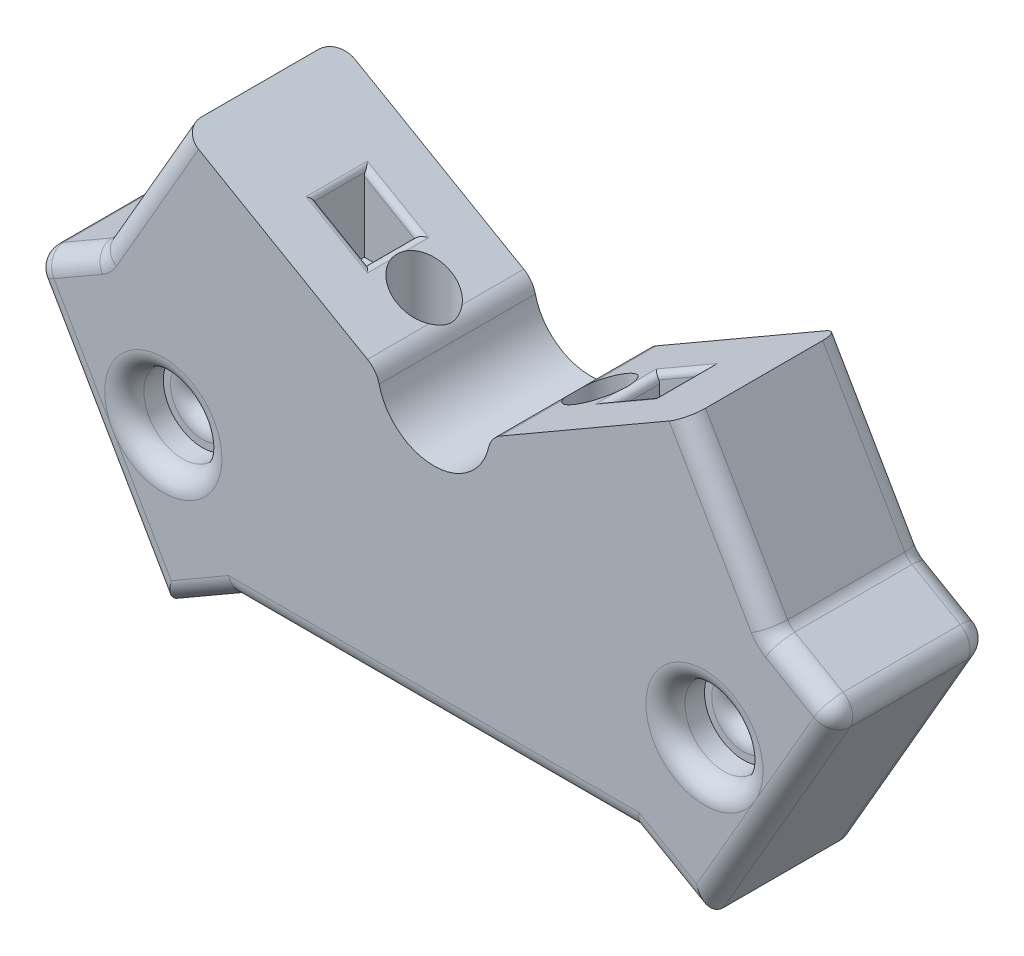
from build123d import *

# Parameters (mm, degrees)
SKETCH3_R                      = 2.286
SKETCH3_R_2                    = 0.5000000000000009
SKETCH3_R_3                    = 0.5000000000000026
SKETCH3_R_4                    = 0.5000000000000006
BOSS_EXTRUDE2_DEPTH            = 6.35
CBORE_FOR_M2_SHCS1_D           = 2.2
CBORE_FOR_M2_SHCS1_CBORE_D     = 4.4
CBORE_FOR_M2_SHCS1_CBORE_DEPTH = 2
CUT_EXTRUDE1_DEPTH             = 33.276392769419495
CUT_EXTRUDE1_DEPTH_BACK        = 7.619999999999999
SKETCH12_R                     = 1.5875000000000001
SKETCH12_R_2                   = 1.5875000000000024
SKETCH12_R_3                   = 1.5875000000000008
CUT_EXTRUDE4_DEPTH             = 1.5875
CUT_EXTRUDE5_START             = -1.5875
SKETCH13_R                     = 1.5875000000000008
SKETCH13_R_2                   = 1.5875000000000001
CUT_EXTRUDE5_DEPTH             = 1.5875
FILLET1_R                      = 0.79375
FILLET2_R                      = 0.79375
CUT_EXTRUDE6_DEPTH             = 24.578353474734403
FILLET3_R                      = 0.396875
FILLET5_R                      = 1
CUT_EXTRUDE10_DEPTH            = 5
FILLET4_R                      = 0.25


# Read off the part's stored shape, not the designer's step: Cut-Extrude9
# Some blends are built 0.0001 mm under size
with BuildPart() as part:
    # Sketch3 → Boss-Extrude2 (new body)
    with BuildSketch(Plane.XY):
        Polygon((5.55625, 12.601292700445448), (5.5562499999999995, 15.874999999999996), (-1.52e-15, 15.875), (-5.556249999999993, 15.874999999999948), (-5.556249999999972, 12.6012927004454), (-13.691164599109024, -1.488792700445434), (-16.526278285077815, -3.125646350222706), (-13.748153285077814, -7.9374999999999964), (-10.970028285077763, -12.749353649777264), (-8.134914599108987, -11.112499999999965), (8.134914599109248, -11.112499999999882), (10.970028285078037, -12.749353649777156), (13.74815328507804, -7.937499999999867), (16.52627828507799, -3.1256463502225516), (13.691164599109184, -1.4887927004453034), align=None)
        Circle(SKETCH3_R, mode=Mode.SUBTRACT)
        with Locations((-10.998522628062338, -6.350000000000054)):
            Circle(SKETCH3_R_2, mode=Mode.SUBTRACT)
        with Locations((10.99852262806243, -6.34999999999989)):
            Circle(SKETCH3_R_3, mode=Mode.SUBTRACT)
        with Locations((0, 12.7)):
            Circle(SKETCH3_R_4, mode=Mode.SUBTRACT)
    extrude(amount=BOSS_EXTRUDE2_DEPTH)

    # CBORE for M2 SHCS1 (through all)
    with Locations(Plane(origin=(2.7499307298664473, 15.875000000000007, 1.2032957578560237), x_dir=(-1, -1.25e-15, 0), z_dir=(-1.25e-15, 1, 0))):
        with Locations((6.32180573, 1.971704242), (-0.82194427, 1.971704242)):
            CounterBoreHole(CBORE_FOR_M2_SHCS1_D / 2, CBORE_FOR_M2_SHCS1_CBORE_D / 2, CBORE_FOR_M2_SHCS1_CBORE_DEPTH)

    # Sketch10 → Cut-Extrude1 (cut, two sides: drawn at the far end of the back side and taken through both)
    with BuildSketch(Plane.XZ.offset(11.112499999999923).offset(-CUT_EXTRUDE1_DEPTH_BACK)):
        Polygon((1.5718750000000006, 2.0202994616207213), (3.5718750000000257, 0.8655989232414972), (5.571875000000009, 2.020299461620783), (5.571874999999974, 4.329700538379291), (3.571874999999952, 5.484401076758515), (1.571874999999965, 4.32970053837923), align=None)
        Polygon((-5.571874999999975, 2.0202994616207475), (-3.5718749999999746, 0.8655989232414972), (-1.5718749999999753, 2.0202994616207497), (-1.5718749999999753, 4.329700538379252), (-3.571874999999975, 5.484401076758503), (-5.5718749999999755, 4.329700538379251), align=None)
    extrude(amount=CUT_EXTRUDE1_DEPTH + CUT_EXTRUDE1_DEPTH_BACK, mode=Mode.SUBTRACT)

    # Sketch12 → Cut-Extrude4 (cut)
    with BuildSketch(Plane.XY.offset(6.35)):
        with Locations((0, 12.7)):
            Circle(SKETCH12_R)
        with Locations((10.99852262806243, -6.34999999999989)):
            Circle(SKETCH12_R_2)
        with Locations((-10.998522628062338, -6.350000000000054)):
            Circle(SKETCH12_R_3)
    extrude(amount=-CUT_EXTRUDE4_DEPTH, mode=Mode.SUBTRACT)

    # Sketch13 → Cut-Extrude5 (cut)
    with BuildSketch(Plane(origin=(0, 0, 0), x_dir=(-1, 0, 0), z_dir=(0, 0, -1)).offset(CUT_EXTRUDE5_START)):
        with Locations(Location((-10.99852262806243, -6.34999999999989, 0), (0, 0, 180))):
            Circle(SKETCH13_R)
        with Locations(Location((0, 12.7, 0), (0, 0, 180))):
            Circle(SKETCH13_R_2)
        with Locations(Location((10.998522628062338, -6.350000000000054, 0), (0, 0, 180))):
            Circle(SKETCH13_R)
    extrude(amount=CUT_EXTRUDE5_DEPTH, mode=Mode.SUBTRACT)

    # Fillet1
    fillet1_edges = [part.edges().sort_by_distance(p)[0] for p in [
        (-0.5000000000000006, 12.7, 4.762499999999999),
        (-1.5875000000000001, 12.7, 6.35),
        (10.498522628062428, -6.34999999999989, 4.762499999999999),
        (9.411022628062428, -6.349999999999891, 6.35),
        (-11.49852262806234, -6.350000000000054, 4.762499999999999),
        (-12.586022628062338, -6.350000000000054, 6.35),
        (10.498522628062428, -6.34999999999989, 1.5875),
        (9.41102262806243, -6.34999999999989, 0),
        (-0.5000000000000006, 12.7, 1.5875),
        (-1.5875000000000001, 12.7, 0),
        (-11.49852262806234, -6.350000000000054, 1.5875),
        (-12.586022628062338, -6.350000000000054, 0),
    ]]
    fillet(fillet1_edges, radius=FILLET1_R)

    # Fillet2
    fillet2_edges = [part.edges().sort_by_distance(p)[0] for p in [
        (3.55e-15, 15.874999999999972, 6.35),
        (15.108721442093586, -2.3072195253339274, 0),
        (13.748153285078013, -7.9374999999998535, 0),
        (9.552471442093642, -11.93092682488852, 0),
        (1.2967e-13, -11.112499999999923, 0),
        (-9.552471442093374, -11.930926824888614, 0),
        (-13.74815328507779, -7.937499999999986, 0),
        (-5.556249999999983, 14.238146350222674, 6.35),
        (-15.108721442093419, -2.30721952533407, 0),
        (-9.623707299554498, 5.5562499999999835, 0),
        (-5.556249999999983, 14.238146350222674, 0),
        (2.66e-15, 15.874999999999972, 0),
        (5.55625, 14.238146350222722, 0),
        (9.623707299554592, 5.556250000000072, 0),
        (-9.623707299554498, 5.5562499999999835, 6.35),
        (-15.108721442093419, -2.30721952533407, 6.35),
        (13.691164599109184, -1.4887927004453034, 3.175),
        (16.52627828507799, -3.1256463502225516, 3.175),
        (-16.526278285077815, -3.125646350222706, 3.175),
        (-13.691164599109024, -1.488792700445434, 3.175),
        (-5.556249999999972, 12.6012927004454, 3.175),
        (-13.74815328507779, -7.937499999999985, 6.35),
        (-5.556249999999993, 15.874999999999948, 5.237435748189045),
        (5.5562499999999995, 15.874999999999996, 5.237435747910032),
        (5.55625, 12.601292700445448, 3.175),
        (-9.552471442093374, -11.930926824888614, 6.35),
        (1.2967e-13, -11.112499999999923, 6.35),
        (9.552471442093642, -11.93092682488852, 6.35),
        (9.623707299554592, 5.556250000000072, 6.35),
        (13.748153285078013, -7.937499999999854, 6.35),
        (15.108721442093586, -2.3072195253339274, 6.35),
        (5.5562499999999995, 15.874999999999996, 1.112564251945991),
        (5.55625, 14.238146350222722, 6.35),
        (-5.556249999999993, 15.874999999999948, 1.1125642516669791),
    ]]
    fillet(fillet2_edges, radius=FILLET2_R - 0.0001)  # a hair under: the kernel refuses the full size

    # Sketch14 → Cut-Extrude6 (cut, through all)
    with BuildSketch(Plane.XY.offset(6.35)):
        Polygon((10.14022568682441, 4.661613910205134), (10.248478862297468, 4.474113910205129), (2.2825799000254072, -0.12499999999999974), (-2.2825799000254072, -0.1250000000000003), (-10.248478862297468, 4.474113910205126), (-10.14022568682441, 4.661613910205132), (-2.2825799000254072, 0.12499999999999971), (2.2825799000254072, 0.12500000000000028), align=None)
    extrude(amount=-CUT_EXTRUDE6_DEPTH, mode=Mode.SUBTRACT)


with BuildPart() as cut_extrude6_piece_1:
    # of the separate pieces the step leaves, piece 1, a body of its own (cut_extrude6_pieces)
    add(part.part.solids().sort_by_distance((10.679532223, -11.665207588, 0))[0])

    # Fillet5
    # the kernel refuses this fillet: 1 mm, written as the material it takes off along each edge
    with BuildSketch(Plane(origin=(2.2825799000254072, -0.12499999999999974, 7.55251195702248), x_dir=(-0.14208852902464092, -0.9898539538333995, 0), z_dir=(0, 0, -1))) as fillet5_piece_1:
        with BuildLine():
            CenterArc((0.48894342934782964, -0.9961425219198927), FILLET5_R, 95.0341838179314, 46.79709768810751)
            Line((-0.29725097619730156, -0.3781632692830927), (0, 0))
            ThreePointArc((0, 0), (0.20059667614665141, -0.00881819489112478), (0.40119335229330066, -1e-17))
        make_face()
    extrude(amount=8.755023914044958, mode=Mode.SUBTRACT)
    with BuildSketch(Plane(origin=(-2.2825799000254072, -0.1250000000000003, 7.552511957022478), x_dir=(-0.866025403784439, 0.4999999999999995, 0), z_dir=(0, 0, -1))) as fillet5_piece_2:
        with BuildLine():
            CenterArc((0.4810047828089911, -1), FILLET5_R, 89.99999999999999, 46.79709768799087)
            ThreePointArc((-0.24792916801167347, -0.31541596911629843), (-0.11703176851653273, -0.16315744604572677), (0, 0))
            Line((0, 0), (0.4810047828089915, -1e-17))
        make_face()
    extrude(amount=8.755023914044957, mode=Mode.SUBTRACT)

    # Sketch18 → Cut-Extrude10 (cut)
    with BuildSketch(Plane(origin=(-7.6e-16, 4.474113910205136, 4.237e-14), x_dir=(-1, -1.7e-16, 0), z_dir=(-1.7e-16, 1, 1.238e-14))):
        Polygon((7, 4.1749999999999785), (7, 2.174999999999979), (5, 2.174999999999978), (5, 4.174999999999979), align=None)
        Polygon((-7, 4.174999999999977), (-5, 4.1749999999999785), (-5, 2.174999999999976), (-7, 2.174999999999977), align=None)
    extrude(amount=-CUT_EXTRUDE10_DEPTH, mode=Mode.SUBTRACT)

    # Fillet4
    # the kernel refuses this fillet: 0.25 mm, written as the material it takes off along each edge
    with BuildSketch(Plane(origin=(4.458734122634719, 1.1314032262216247, 2.1749999999999767), x_dir=(5.33e-15, 4.3e-15, -1), z_dir=(0.8660254037844389, 0.49999999999999956, 6.7690775915540635e-15))) as fillet4_piece_1_section:
        with BuildLine():
            CenterArc((FILLET4_R, -FILLET4_R), FILLET4_R, 89.99999999999993, 90.00000000000063)
            Line((1.95e-15, -FILLET4_R), (0, 0))
            Line((0, 0), (FILLET4_R, 0))
        make_face()
    fillet4_piece_1 = extrude(amount=3.559401076758515, mode=Mode.PRIVATE)
    fillet4_piece_1 = split(fillet4_piece_1, bisect_by=Plane(origin=(6.999999999999999, 1.1314032262216251, 2.1749999999999767), z_dir=(-1, -1.7e-16, 0)), keep=Keep.TOP, mode=Mode.PRIVATE)
    fillet4_piece_1 = split(fillet4_piece_1, bisect_by=Plane(origin=(4.999999999999999, 1.1314032262216247, 2.1749999999999767), z_dir=(1, 1.7e-16, 0)), keep=Keep.TOP, mode=Mode.PRIVATE)
    add(fillet4_piece_1, mode=Mode.SUBTRACT)
    with BuildSketch(Plane(origin=(5, 1.443903226221629, 4.174999999999984), x_dir=(-0.8660254037844387, -0.4999999999999997, 0), z_dir=(0, 0, -1))) as fillet4_piece_2:
        with BuildLine():
            CenterArc((FILLET4_R * 1.73205080757, -FILLET4_R), FILLET4_R, 90, 119.9999999999998)
            Line((FILLET4_R * 0.866025403784, -FILLET4_R * 1.5), (0, 0))
            Line((0, 0), (FILLET4_R * 1.73205080757, -1e-17))
        make_face()
    extrude(amount=2.0000000000000036, mode=Mode.SUBTRACT)
    with BuildSketch(Plane(origin=(7.541265877365268, 2.9111037646008757, 4.175000000000001), x_dir=(-3.4e-15, -4.96e-15, 1), z_dir=(-0.8660254037844389, -0.49999999999999956, -5.423003711085568e-15))) as fillet4_piece_3_section:
        with BuildLine():
            CenterArc((FILLET4_R, -FILLET4_R), FILLET4_R, 90.00000000000016, 89.99999999999913)
            Line((-2.01e-15, -FILLET4_R), (0, 0))
            Line((0, 0), (FILLET4_R, 0))
        make_face()
    fillet4_piece_3 = extrude(amount=3.559401076758489, mode=Mode.PRIVATE)
    fillet4_piece_3 = split(fillet4_piece_3, bisect_by=Plane(origin=(6.999999999999999, 2.9111037646008757, 4.175000000000001), z_dir=(-1, -1.7e-16, 0)), keep=Keep.TOP, mode=Mode.PRIVATE)
    fillet4_piece_3 = split(fillet4_piece_3, bisect_by=Plane(origin=(4.999999999999999, 2.9111037646008753, 4.175000000000001), z_dir=(1, 1.7e-16, 0)), keep=Keep.TOP, mode=Mode.PRIVATE)
    add(fillet4_piece_3, mode=Mode.SUBTRACT)
    with BuildSketch(Plane(origin=(7, 2.5986037646008793, 2.1749999999999963), x_dir=(0.8660254037844398, 0.499999999999998, 0), z_dir=(0, 0, 1))) as fillet4_piece_4:
        with BuildLine():
            CenterArc((FILLET4_R * 0.57735026919, -FILLET4_R), FILLET4_R, 90.00000000000011, 59.999999999999915)
            Line((-FILLET4_R * 0.288675134595, -FILLET4_R * 0.5), (0, 0))
            Line((0, 0), (FILLET4_R * 0.57735026919, -1e-17))
        make_face()
    extrude(amount=2, mode=Mode.SUBTRACT)
    with BuildSketch(Plane(origin=(-7.000000000000001, 2.5986037646008775, 4.174999999999998), x_dir=(-0.8660254037844385, 0.5000000000000003, 0), z_dir=(0, 0, -1))) as fillet4_piece_5:
        with BuildLine():
            CenterArc((FILLET4_R * 0.57735026919, -FILLET4_R), FILLET4_R, 89.99999999999996, 59.999999999999815)
            Line((-FILLET4_R * 0.288675134595, -FILLET4_R * 0.5), (0, 0))
            Line((0, 0), (FILLET4_R * 0.57735026919, -1e-17))
        make_face()
    extrude(amount=2, mode=Mode.SUBTRACT)
    with BuildSketch(Plane(origin=(-4.4587341226347315, 1.131403226221632, 4.17499999999998), x_dir=(4.38e-15, -4.03e-15, 1), z_dir=(-0.866025403784439, 0.49999999999999933, 5.807596248362279e-15))) as fillet4_piece_6_section:
        with BuildLine():
            CenterArc((FILLET4_R, -FILLET4_R), FILLET4_R, 90.00000000000007, 89.9999999999991)
            Line((-2.34e-15, -FILLET4_R), (0, 0))
            Line((0, 0), (FILLET4_R, 0))
        make_face()
    fillet4_piece_6 = extrude(amount=3.5594010767584896, mode=Mode.PRIVATE)
    fillet4_piece_6 = split(fillet4_piece_6, bisect_by=Plane(origin=(-7.000000000000001, 1.1314032262216316, 4.17499999999998), z_dir=(1, 1.7e-16, 0)), keep=Keep.TOP, mode=Mode.PRIVATE)
    fillet4_piece_6 = split(fillet4_piece_6, bisect_by=Plane(origin=(-5.000000000000001, 1.131403226221632, 4.17499999999998), z_dir=(-1, -1.7e-16, 0)), keep=Keep.TOP, mode=Mode.PRIVATE)
    add(fillet4_piece_6, mode=Mode.SUBTRACT)
    with BuildSketch(Plane(origin=(-5, 1.4439032262216278, 2.1749999999999825), x_dir=(0.8660254037844392, -0.4999999999999991, 0), z_dir=(0, 0, 1))) as fillet4_piece_7:
        with BuildLine():
            CenterArc((FILLET4_R * 1.73205080757, -FILLET4_R), FILLET4_R, 89.99999999999996, 119.99999999999994)
            Line((FILLET4_R * 0.866025403784, -FILLET4_R * 1.5), (0, 0))
            Line((0, 0), (FILLET4_R * 1.73205080757, 0))
        make_face()
    extrude(amount=2.000000000000002, mode=Mode.SUBTRACT)
    with BuildSketch(Plane(origin=(-7.541265877365281, 2.91110376460088, 2.175000000000002), x_dir=(-5.93e-15, 2.88e-15, -1), z_dir=(0.866025403784439, -0.49999999999999933, -6.576781322915705e-15))) as fillet4_piece_8_section:
        with BuildLine():
            CenterArc((FILLET4_R, -FILLET4_R), FILLET4_R, 90.00000000000003, 90.0000000000004)
            Line((2.78e-15, -FILLET4_R), (0, 0))
            Line((0, 0), (FILLET4_R, 0))
        make_face()
    fillet4_piece_8 = extrude(amount=3.5594010767585162, mode=Mode.PRIVATE)
    fillet4_piece_8 = split(fillet4_piece_8, bisect_by=Plane(origin=(-5.000000000000001, 2.9111037646008806, 2.175000000000002), z_dir=(-1, -1.7e-16, 0)), keep=Keep.TOP, mode=Mode.PRIVATE)
    fillet4_piece_8 = split(fillet4_piece_8, bisect_by=Plane(origin=(-7.000000000000001, 2.91110376460088, 2.175000000000002), z_dir=(1, 1.7e-16, 0)), keep=Keep.TOP, mode=Mode.PRIVATE)
    add(fillet4_piece_8, mode=Mode.SUBTRACT)
    with BuildSketch(Plane(origin=(4.458734122634719, 1.1314032262216247, 2.1749999999999767), x_dir=(5.33e-15, 4.3e-15, -1), z_dir=(0.8660254037844389, 0.49999999999999956, 6.7690775915540635e-15))) as fillet4_piece_9a_section:
        with BuildLine():
            CenterArc((FILLET4_R, -FILLET4_R), FILLET4_R, 89.99999999999993, 90.00000000000063)
            Line((1.95e-15, -FILLET4_R), (0, 0))
            Line((0, 0), (FILLET4_R, 0))
        make_face()
    fillet4_piece_9a = extrude(amount=3.559401076758515, mode=Mode.PRIVATE)
    fillet4_piece_9a = split(fillet4_piece_9a, bisect_by=Plane(origin=(5, 1.1314032262216247, 2.1749999999999767), z_dir=(-1, -1.7e-16, 0)), keep=Keep.TOP, mode=Mode.PRIVATE)
    with BuildSketch(Plane(origin=(5, 1.443903226221629, 4.174999999999984), x_dir=(-0.8660254037844387, -0.4999999999999997, 0), z_dir=(0, 0, -1))) as fillet4_piece_9b_section:
        with BuildLine():
            CenterArc((FILLET4_R * 1.73205080757, -FILLET4_R), FILLET4_R, 90, 119.9999999999998)
            Line((FILLET4_R * 0.866025403784, -FILLET4_R * 1.5), (0, 0))
            Line((0, 0), (FILLET4_R * 1.73205080757, -1e-17))
        make_face()
    fillet4_piece_9b = extrude(amount=3.082531754730554, mode=Mode.PRIVATE)
    fillet4_piece_9b = split(fillet4_piece_9b, bisect_by=Plane(origin=(5.000000000000002, 1.4439032262216538, 2.1749999999999807), z_dir=(6.7e-16, 1.238e-14, -1)), keep=Keep.TOP, mode=Mode.PRIVATE)
    fillet4_piece_9 = fillet4_piece_9a & fillet4_piece_9b
    add(fillet4_piece_9, mode=Mode.SUBTRACT)
    with BuildSketch(Plane(origin=(7, 2.5986037646008793, 1.81415608175648), x_dir=(0.8660254037844398, 0.499999999999998, 0), z_dir=(0, 0, 1))) as fillet4_piece_10a_section:
        with BuildLine():
            CenterArc((FILLET4_R * 0.57735026919, -FILLET4_R), FILLET4_R, 90.00000000000011, 59.999999999999915)
            Line((-FILLET4_R * 0.288675134595, -FILLET4_R * 0.5), (0, 0))
            Line((0, 0), (FILLET4_R * 0.57735026919, -1e-17))
        make_face()
    fillet4_piece_10a = extrude(amount=2.3608439182435164, mode=Mode.PRIVATE)
    fillet4_piece_10a = split(fillet4_piece_10a, bisect_by=Plane(origin=(7, 2.598603764600875, 2.174999999999996), z_dir=(6.7e-16, 1.238e-14, -1)), keep=Keep.TOP, mode=Mode.PRIVATE)
    with BuildSketch(Plane(origin=(4.458734122634719, 1.1314032262216247, 2.1749999999999767), x_dir=(5.33e-15, 4.3e-15, -1), z_dir=(0.8660254037844389, 0.49999999999999956, 6.7690775915540635e-15))) as fillet4_piece_10b_section:
        with BuildLine():
            CenterArc((FILLET4_R, -FILLET4_R), FILLET4_R, 89.99999999999993, 90.00000000000063)
            Line((1.95e-15, -FILLET4_R), (0, 0))
            Line((0, 0), (FILLET4_R, 0))
        make_face()
    fillet4_piece_10b = extrude(amount=3.559401076758515, mode=Mode.PRIVATE)
    fillet4_piece_10b = split(fillet4_piece_10b, bisect_by=Plane(origin=(7, 1.1314032262216251, 2.1749999999999767), z_dir=(1, 1.7e-16, 0)), keep=Keep.TOP, mode=Mode.PRIVATE)
    fillet4_piece_10 = fillet4_piece_10a & fillet4_piece_10b
    add(fillet4_piece_10, mode=Mode.SUBTRACT)
    with BuildSketch(Plane(origin=(5, 1.443903226221629, 5.257531754730534), x_dir=(-0.8660254037844387, -0.4999999999999997, 0), z_dir=(0, 0, -1))) as fillet4_piece_11a_section:
        with BuildLine():
            CenterArc((FILLET4_R * 1.73205080757, -FILLET4_R), FILLET4_R, 90, 119.9999999999998)
            Line((FILLET4_R * 0.866025403784, -FILLET4_R * 1.5), (0, 0))
            Line((0, 0), (FILLET4_R * 1.73205080757, -1e-17))
        make_face()
    fillet4_piece_11a = extrude(amount=3.082531754730554, mode=Mode.PRIVATE)
    fillet4_piece_11a = split(fillet4_piece_11a, bisect_by=Plane(origin=(4.999999999999999, 1.4439032262216422, 4.174999999999984), z_dir=(8.9e-16, -1.238e-14, 1)), keep=Keep.TOP, mode=Mode.PRIVATE)
    with BuildSketch(Plane(origin=(7.541265877365268, 2.9111037646008757, 4.175000000000001), x_dir=(-3.4e-15, -4.96e-15, 1), z_dir=(-0.8660254037844389, -0.49999999999999956, -5.423003711085568e-15))) as fillet4_piece_11b_section:
        with BuildLine():
            CenterArc((FILLET4_R, -FILLET4_R), FILLET4_R, 90.00000000000016, 89.99999999999913)
            Line((-2.01e-15, -FILLET4_R), (0, 0))
            Line((0, 0), (FILLET4_R, 0))
        make_face()
    fillet4_piece_11b = extrude(amount=3.559401076758489, mode=Mode.PRIVATE)
    fillet4_piece_11b = split(fillet4_piece_11b, bisect_by=Plane(origin=(5, 2.9111037646008753, 4.175000000000001), z_dir=(-1, -1.7e-16, 0)), keep=Keep.TOP, mode=Mode.PRIVATE)
    fillet4_piece_11 = fillet4_piece_11a & fillet4_piece_11b
    add(fillet4_piece_11, mode=Mode.SUBTRACT)
    with BuildSketch(Plane(origin=(7, 2.5986037646008793, 2.1749999999999963), x_dir=(0.8660254037844398, 0.499999999999998, 0), z_dir=(0, 0, 1))) as fillet4_piece_12a_section:
        with BuildLine():
            CenterArc((FILLET4_R * 0.57735026919, -FILLET4_R), FILLET4_R, 90.00000000000011, 59.999999999999915)
            Line((-FILLET4_R * 0.288675134595, -FILLET4_R * 0.5), (0, 0))
            Line((0, 0), (FILLET4_R * 0.57735026919, -1e-17))
        make_face()
    fillet4_piece_12a = extrude(amount=2.360843918243517, mode=Mode.PRIVATE)
    fillet4_piece_12a = split(fillet4_piece_12a, bisect_by=Plane(origin=(7.000000000000002, 2.5986037646008544, 4.174999999999996), z_dir=(8.9e-16, -1.238e-14, 1)), keep=Keep.TOP, mode=Mode.PRIVATE)
    with BuildSketch(Plane(origin=(7.541265877365268, 2.9111037646008757, 4.175000000000001), x_dir=(-3.4e-15, -4.96e-15, 1), z_dir=(-0.8660254037844389, -0.49999999999999956, -5.423003711085568e-15))) as fillet4_piece_12b_section:
        with BuildLine():
            CenterArc((FILLET4_R, -FILLET4_R), FILLET4_R, 90.00000000000016, 89.99999999999913)
            Line((-2.01e-15, -FILLET4_R), (0, 0))
            Line((0, 0), (FILLET4_R, 0))
        make_face()
    fillet4_piece_12b = extrude(amount=3.559401076758489, mode=Mode.PRIVATE)
    fillet4_piece_12b = split(fillet4_piece_12b, bisect_by=Plane(origin=(6.999999999999999, 2.9111037646008757, 4.175000000000001), z_dir=(1, 1.7e-16, 0)), keep=Keep.TOP, mode=Mode.PRIVATE)
    fillet4_piece_12 = fillet4_piece_12a & fillet4_piece_12b
    add(fillet4_piece_12, mode=Mode.SUBTRACT)
    with BuildSketch(Plane(origin=(-4.4587341226347315, 1.131403226221632, 4.17499999999998), x_dir=(4.38e-15, -4.03e-15, 1), z_dir=(-0.866025403784439, 0.49999999999999933, 5.807596248362279e-15))) as fillet4_piece_13a_section:
        with BuildLine():
            CenterArc((FILLET4_R, -FILLET4_R), FILLET4_R, 90.00000000000007, 89.9999999999991)
            Line((-2.34e-15, -FILLET4_R), (0, 0))
            Line((0, 0), (FILLET4_R, 0))
        make_face()
    fillet4_piece_13a = extrude(amount=3.5594010767584896, mode=Mode.PRIVATE)
    fillet4_piece_13a = split(fillet4_piece_13a, bisect_by=Plane(origin=(-7, 1.1314032262216316, 4.17499999999998), z_dir=(-1, -1.7e-16, 0)), keep=Keep.TOP, mode=Mode.PRIVATE)
    with BuildSketch(Plane(origin=(-7.000000000000001, 2.5986037646008775, 4.535843918243514), x_dir=(-0.8660254037844385, 0.5000000000000003, 0), z_dir=(0, 0, -1))) as fillet4_piece_13b_section:
        with BuildLine():
            CenterArc((FILLET4_R * 0.57735026919, -FILLET4_R), FILLET4_R, 89.99999999999996, 59.999999999999815)
            Line((-FILLET4_R * 0.288675134595, -FILLET4_R * 0.5), (0, 0))
            Line((0, 0), (FILLET4_R * 0.57735026919, -1e-17))
        make_face()
    fillet4_piece_13b = extrude(amount=2.360843918243516, mode=Mode.PRIVATE)
    fillet4_piece_13b = split(fillet4_piece_13b, bisect_by=Plane(origin=(-7.000000000000001, 2.598603764600882, 4.174999999999998), z_dir=(-4.4e-16, -1.238e-14, 1)), keep=Keep.TOP, mode=Mode.PRIVATE)
    fillet4_piece_13 = fillet4_piece_13a & fillet4_piece_13b
    add(fillet4_piece_13, mode=Mode.SUBTRACT)
    with BuildSketch(Plane(origin=(-7.541265877365281, 2.91110376460088, 2.175000000000002), x_dir=(-5.93e-15, 2.88e-15, -1), z_dir=(0.866025403784439, -0.49999999999999933, -6.576781322915705e-15))) as fillet4_piece_14a_section:
        with BuildLine():
            CenterArc((FILLET4_R, -FILLET4_R), FILLET4_R, 90.00000000000003, 90.0000000000004)
            Line((2.78e-15, -FILLET4_R), (0, 0))
            Line((0, 0), (FILLET4_R, 0))
        make_face()
    fillet4_piece_14a = extrude(amount=3.5594010767585162, mode=Mode.PRIVATE)
    fillet4_piece_14a = split(fillet4_piece_14a, bisect_by=Plane(origin=(-7.000000000000001, 2.91110376460088, 2.175000000000002), z_dir=(-1, -1.7e-16, 0)), keep=Keep.TOP, mode=Mode.PRIVATE)
    with BuildSketch(Plane(origin=(-7.000000000000001, 2.5986037646008775, 4.174999999999998), x_dir=(-0.8660254037844385, 0.5000000000000003, 0), z_dir=(0, 0, -1))) as fillet4_piece_14b_section:
        with BuildLine():
            CenterArc((FILLET4_R * 0.57735026919, -FILLET4_R), FILLET4_R, 89.99999999999996, 59.999999999999815)
            Line((-FILLET4_R * 0.288675134595, -FILLET4_R * 0.5), (0, 0))
            Line((0, 0), (FILLET4_R * 0.57735026919, -1e-17))
        make_face()
    fillet4_piece_14b = extrude(amount=2.360843918243516, mode=Mode.PRIVATE)
    fillet4_piece_14b = split(fillet4_piece_14b, bisect_by=Plane(origin=(-7.000000000000002, 2.5986037646009024, 2.1749999999999976), z_dir=(-4.4e-16, 1.238e-14, -1)), keep=Keep.TOP, mode=Mode.PRIVATE)
    fillet4_piece_14 = fillet4_piece_14a & fillet4_piece_14b
    add(fillet4_piece_14, mode=Mode.SUBTRACT)
    with BuildSketch(Plane(origin=(-4.4587341226347315, 1.131403226221632, 4.17499999999998), x_dir=(4.38e-15, -4.03e-15, 1), z_dir=(-0.866025403784439, 0.49999999999999933, 5.807596248362279e-15))) as fillet4_piece_15a_section:
        with BuildLine():
            CenterArc((FILLET4_R, -FILLET4_R), FILLET4_R, 90.00000000000007, 89.9999999999991)
            Line((-2.34e-15, -FILLET4_R), (0, 0))
            Line((0, 0), (FILLET4_R, 0))
        make_face()
    fillet4_piece_15a = extrude(amount=3.5594010767584896, mode=Mode.PRIVATE)
    fillet4_piece_15a = split(fillet4_piece_15a, bisect_by=Plane(origin=(-5, 1.131403226221632, 4.17499999999998), z_dir=(1, 1.7e-16, 0)), keep=Keep.TOP, mode=Mode.PRIVATE)
    with BuildSketch(Plane(origin=(-5, 1.4439032262216278, 2.1749999999999825), x_dir=(0.8660254037844392, -0.4999999999999991, 0), z_dir=(0, 0, 1))) as fillet4_piece_15b_section:
        with BuildLine():
            CenterArc((FILLET4_R * 1.73205080757, -FILLET4_R), FILLET4_R, 89.99999999999996, 119.99999999999994)
            Line((FILLET4_R * 0.866025403784, -FILLET4_R * 1.5), (0, 0))
            Line((0, 0), (FILLET4_R * 1.73205080757, 0))
        make_face()
    fillet4_piece_15b = extrude(amount=3.08253175473055, mode=Mode.PRIVATE)
    fillet4_piece_15b = split(fillet4_piece_15b, bisect_by=Plane(origin=(-5.000000000000001, 1.443903226221603, 4.174999999999985), z_dir=(-4.4e-16, -1.238e-14, 1)), keep=Keep.TOP, mode=Mode.PRIVATE)
    fillet4_piece_15 = fillet4_piece_15a & fillet4_piece_15b
    add(fillet4_piece_15, mode=Mode.SUBTRACT)
    with BuildSketch(Plane(origin=(-5, 1.4439032262216278, 1.0924682452694352), x_dir=(0.8660254037844392, -0.4999999999999991, 0), z_dir=(0, 0, 1))) as fillet4_piece_16a_section:
        with BuildLine():
            CenterArc((FILLET4_R * 1.73205080757, -FILLET4_R), FILLET4_R, 89.99999999999996, 119.99999999999994)
            Line((FILLET4_R * 0.866025403784, -FILLET4_R * 1.5), (0, 0))
            Line((0, 0), (FILLET4_R * 1.73205080757, 0))
        make_face()
    fillet4_piece_16a = extrude(amount=3.0825317547305495, mode=Mode.PRIVATE)
    fillet4_piece_16a = split(fillet4_piece_16a, bisect_by=Plane(origin=(-4.999999999999999, 1.4439032262216145, 2.174999999999983), z_dir=(-4.4e-16, 1.238e-14, -1)), keep=Keep.TOP, mode=Mode.PRIVATE)
    with BuildSketch(Plane(origin=(-7.541265877365281, 2.91110376460088, 2.175000000000002), x_dir=(-5.93e-15, 2.88e-15, -1), z_dir=(0.866025403784439, -0.49999999999999933, -6.576781322915705e-15))) as fillet4_piece_16b_section:
        with BuildLine():
            CenterArc((FILLET4_R, -FILLET4_R), FILLET4_R, 90.00000000000003, 90.0000000000004)
            Line((2.78e-15, -FILLET4_R), (0, 0))
            Line((0, 0), (FILLET4_R, 0))
        make_face()
    fillet4_piece_16b = extrude(amount=3.5594010767585162, mode=Mode.PRIVATE)
    fillet4_piece_16b = split(fillet4_piece_16b, bisect_by=Plane(origin=(-5, 2.9111037646008806, 2.175000000000002), z_dir=(1, 1.7e-16, 0)), keep=Keep.TOP, mode=Mode.PRIVATE)
    fillet4_piece_16 = fillet4_piece_16a & fillet4_piece_16b
    add(fillet4_piece_16, mode=Mode.SUBTRACT)


with BuildPart() as cut_extrude6_piece_2:
    # of the separate pieces the step leaves, piece 2, a body of its own (cut_extrude6_pieces)
    add(part.part.solids().sort_by_distance((2.2825799, 0.125, 0))[0])

    # Fillet3
    # the kernel refuses this fillet: 0.396875 mm, written as the material it takes off along each edge
    with BuildSketch(Plane(origin=(2.2825799000254072, 0.12500000000000028, 7.767721475471494), x_dir=(0.8660254037844385, 0.5000000000000002, 0), z_dir=(0, 0, -1))) as fillet3_piece_1:
        with BuildLine():
            CenterArc((0.5670885901885976, -0.39687500000000003), FILLET3_R, 89.99999999999997, 103.71658856406918)
            ThreePointArc((0.18153226329830982, -0.490981771381605), (0.10486610473398783, -0.24027765746985996), (0, 0))
            Line((0, 0), (0.5670885901885978, 1e-17))
        make_face()
    extrude(amount=9.185442950942988, mode=Mode.SUBTRACT)
    with BuildSketch(Plane(origin=(-2.2825799000254072, 0.12499999999999971, 7.767721475471493), x_dir=(0.168643747899259, 0.9856770699851403, 0), z_dir=(0, 0, -1))) as fillet3_piece_2:
        with BuildLine():
            CenterArc((0.5689061818238179, -0.3942651278387892), FILLET3_R, 96.5744383798922, 103.71658856406907)
            Line((0.1966599519065027, -0.5318969189967383), (0, 0))
            ThreePointArc((0, 0), (0.26173319547166046, -0.01503286364857464), (0.523466390943321, 0))
        make_face()
    extrude(amount=9.185442950942985, mode=Mode.SUBTRACT)


solid = cut_extrude6_piece_1.part
